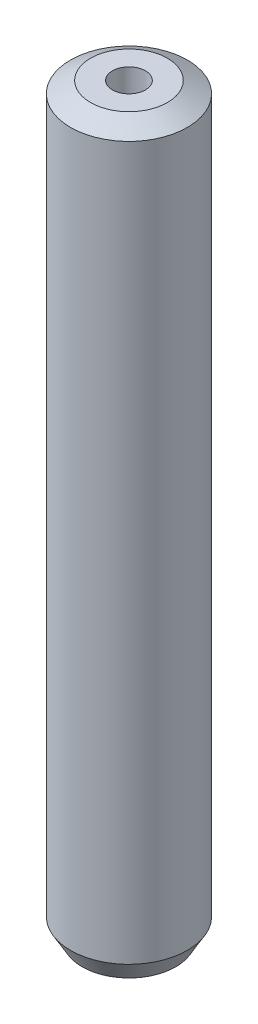
from build123d import *
from OCP.BRepFilletAPI import BRepFilletAPI_MakeChamfer

# Parameters (mm, degrees)
SKETCH1_R           = 15
BOSS_EXTRUDE1_DEPTH = 191.04329885
SKETCH2_R           = 4.245818369
CUT_EXTRUDE1_DEPTH  = 193.217434265
CHAMFER1_SIZE       = 2.965930143
CHAMFER1_SIZE2      = 5.137141699


with BuildPart() as part:
    # Sketch1 → Boss-Extrude1 (new body)
    with BuildSketch(Plane(origin=(0, 0, 0), x_dir=(1, 0, 0), z_dir=(0, 1, 0))):
        Circle(SKETCH1_R)
    extrude(amount=BOSS_EXTRUDE1_DEPTH)

    # Sketch2 → Cut-Extrude1 (cut, through all)
    with BuildSketch(Plane(origin=(0, 0, 0), x_dir=(1, 0, 0), z_dir=(0, 1, 0))):
        Circle(SKETCH2_R)
    extrude(amount=CUT_EXTRUDE1_DEPTH, mode=Mode.SUBTRACT)

    # Chamfer1: one chamfer whose edges measure the first distance from different faces: ONE call of the kernel's chamfer builder (chamfer() names one face for all edges)
    chamfer1_edges_1 = [part.edges().sort_by_distance(p)[0] for p in [
        (-15, 191.04329885, 0),
    ]]
    chamfer1_side_1 = [part.faces().sort_by_distance(p)[0] for p in [
        (-15, 95.521649425, 0),
    ]]
    chamfer1_edges_2 = [part.edges().sort_by_distance(p)[0] for p in [
        (-15, 0, 0),
    ]]
    chamfer1_side_2 = [part.faces().sort_by_distance(p)[0] for p in [
        (-14.575735931, 0, 0),
    ]]
    chamfer1 = BRepFilletAPI_MakeChamfer(part.part.solid().wrapped)
    for e in chamfer1_edges_1:
        chamfer1.Add(CHAMFER1_SIZE, CHAMFER1_SIZE2, e.wrapped, chamfer1_side_1[0].wrapped)  # the first distance lies on this face
    for e in chamfer1_edges_2:
        chamfer1.Add(CHAMFER1_SIZE, CHAMFER1_SIZE2, e.wrapped, chamfer1_side_2[0].wrapped)  # the first distance lies on this face
    add(Compound.cast(chamfer1.Shape()), mode=Mode.REPLACE)


solid = part.part
